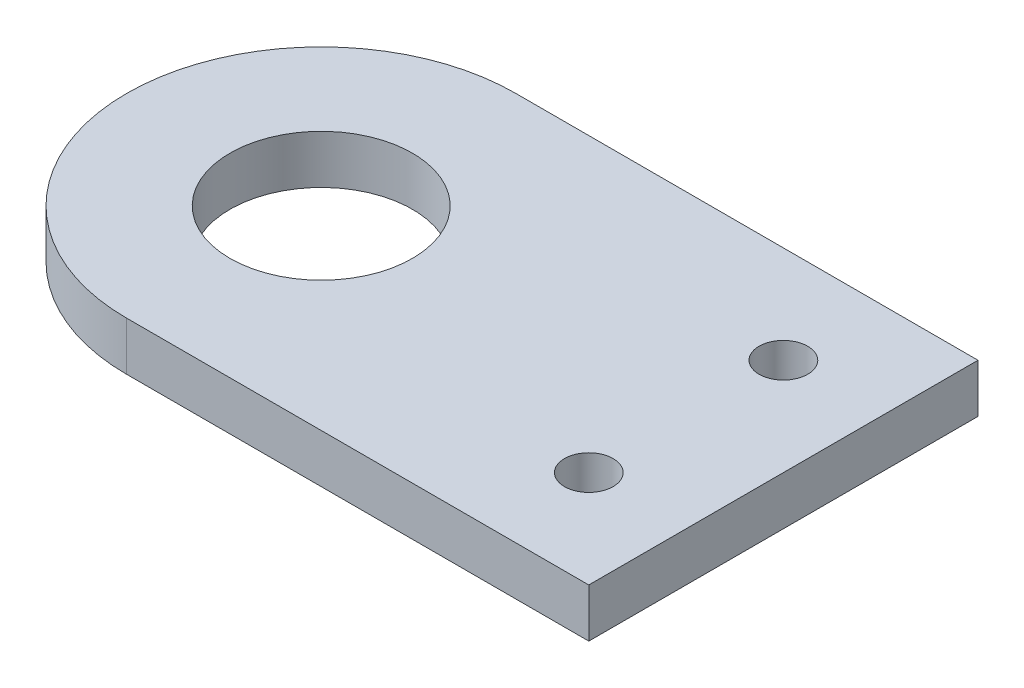
from build123d import *

# Parameters (mm, degrees)
SKETCH1_R           = 7.5
BOSS_EXTRUDE1_DEPTH = 4
SKETCH2_R           = 2
CUT_EXTRUDE1_DEPTH  = 42.424630354


with BuildPart() as part:
    # Sketch1 → Boss-Extrude1 (new body)
    with BuildSketch(Plane(origin=(0, 0, 0), x_dir=(1, 0, 0), z_dir=(0, 1, 0))):
        with BuildLine():
            Line((38, 16), (0, 16))
            ThreePointArc((0, 16), (-16, 0), (0, -16))
            Line((0, -16), (38, -16))
            Line((38, -16), (38, 16))
        make_face()
        Circle(SKETCH1_R, mode=Mode.SUBTRACT)
    extrude(amount=BOSS_EXTRUDE1_DEPTH)

    # Sketch2 → Cut-Extrude1 (cut, through all)
    with BuildSketch(Plane(origin=(0, 4, 0), x_dir=(1, 0, 0), z_dir=(0, 1, 0))):
        with Locations((30, 8)):
            Circle(SKETCH2_R)
        with Locations((30, -8)):
            Circle(SKETCH2_R)
    extrude(amount=-CUT_EXTRUDE1_DEPTH, mode=Mode.SUBTRACT)


solid = part.part
